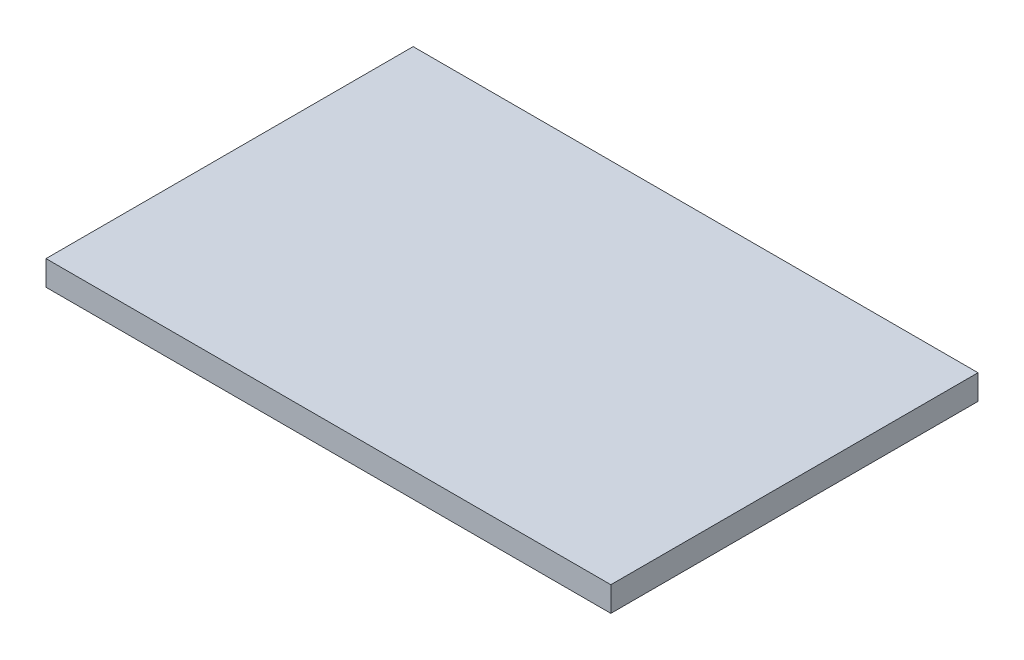
from build123d import *

# Parameters (mm, degrees)
SKETCH1_W           = 127
SKETCH1_H           = 82.55
BOSS_EXTRUDE1_DEPTH = 5.588


with BuildPart() as part:
    # Sketch1 → Boss-Extrude1 (new body)
    with BuildSketch(Plane(origin=(0, 0, 0), x_dir=(1, 0, 0), z_dir=(0, 1, 0))):
        Rectangle(SKETCH1_W, SKETCH1_H)
    extrude(amount=BOSS_EXTRUDE1_DEPTH)


solid = part.part
